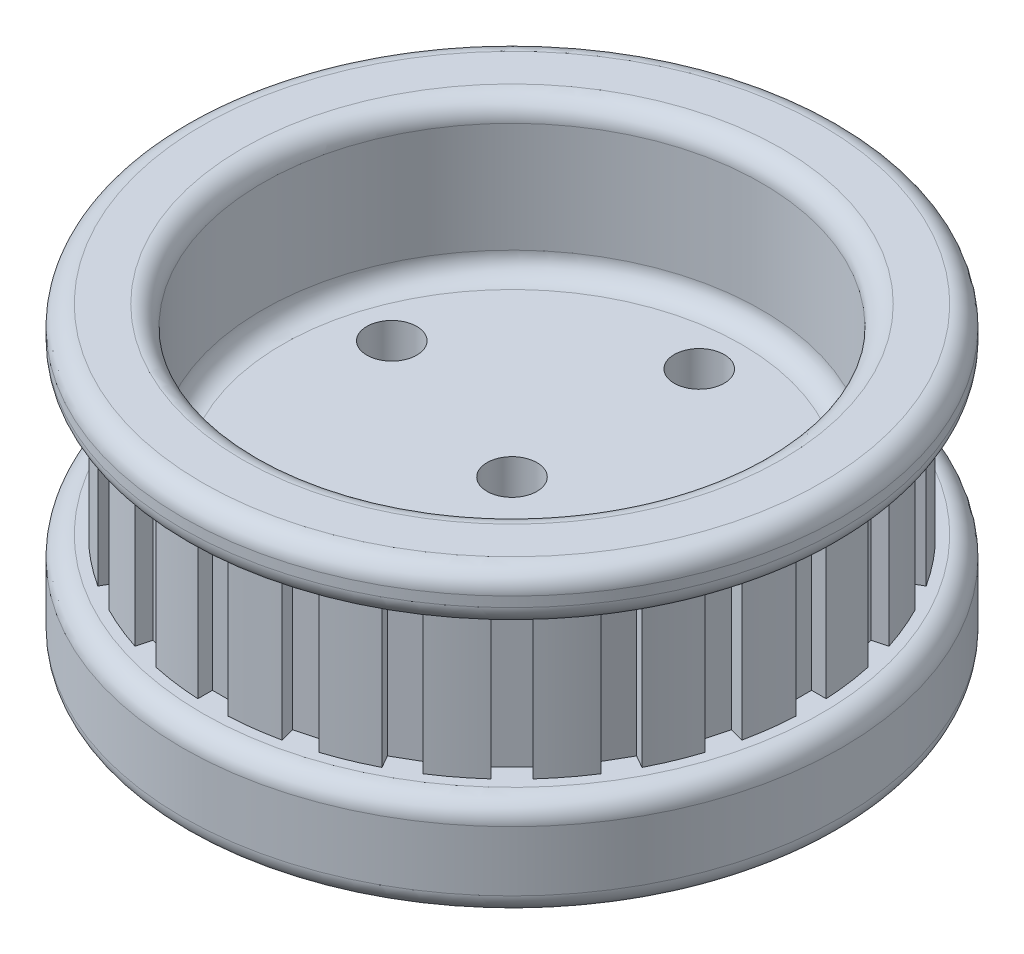
from build123d import *

# Parameters (mm, degrees)
SKETCH2_R          = 2.5
CUT_EXTRUDE1_DEPTH = 10
SKETCH3_W          = 3
SKETCH3_H          = 3
CUT_EXTRUDE2_DEPTH = 15
CIRPATTERN1_START  = 5
CIRPATTERN1_DEPTH  = 15
FILLET1_R          = 2


# Read off the part's stored shape, not the designer's step: CirPattern1
with BuildPart() as part:
    # Sketch1 → Revolve1 (revolve)
    with BuildSketch(Plane.XY, mode=Mode.PRIVATE) as revolve1_sk:
        Polygon((25, 10), (25, 25), (33, 25), (33, 20), (30, 20), (30, 5), (33, 5), (33, -5), (25, -5), (25, 0), (0, 0), (0, 10), align=None)
    revolve(revolve1_sk.sketch.rotate(Axis((0, 0, 0), (0, 1, 0)), 90), axis=Axis((0, 0, 0), (0, 1, 0)))

    # Sketch2 → Cut-Extrude1 (cut)
    with BuildSketch(Plane(origin=(0, 10, 0), x_dir=(1, 0, 0), z_dir=(0, 1, 0))):
        with Locations(Location((0, 0, 0), (0, 0, 270))):
            Circle(SKETCH2_R)
        with Locations(Location((0, 18.75, 0), (0, 0, 270))):
            Circle(SKETCH2_R)
        with Locations(Location((17.832309681, 5.794068645, 0), (0, 0, 270))):
            Circle(SKETCH2_R)
        with Locations(Location((11.02097348, -15.169068645, 0), (0, 0, 270))):
            Circle(SKETCH2_R)
        with Locations(Location((-11.02097348, -15.169068645, 0), (0, 0, 270))):
            Circle(SKETCH2_R)
        with Locations(Location((-17.832309681, 5.794068645, 0), (0, 0, 270))):
            Circle(SKETCH2_R)
    extrude(amount=-CUT_EXTRUDE1_DEPTH, mode=Mode.SUBTRACT)

    # Sketch3 → Cut-Extrude2 (cut)
    with BuildSketch(Plane(origin=(0, 5, 0), x_dir=(1, 0, 0), z_dir=(0, 1, 0))):
        with Locations((0, 30)):
            Rectangle(SKETCH3_W, SKETCH3_H)
    extrude(amount=CUT_EXTRUDE2_DEPTH, mode=Mode.SUBTRACT)

    # CirPattern1 outline → CirPattern1 (cut)
    with BuildSketch(Plane(origin=(0, 0, 0), x_dir=(1, 0, 0), z_dir=(0, 1, 0)).offset(CIRPATTERN1_START)):
        with BuildLine():
            Line((8.825231525, 27.140657482), (9.203748305, 28.553301335))
            ThreePointArc((9.203748305, 28.553301335), (7.764571353, 28.977774788), (6.305970826, 29.32975847))
            Line((6.305970826, 29.32975847), (5.927454046, 27.917114617))
            Line((5.927454046, 27.917114617), (8.825231525, 27.140657482))
        make_face()
        with BuildLine():
            Line((15.549038106, 23.931724008), (16.280276372, 25.198265838))
            ThreePointArc((16.280276372, 25.198265838), (15, 25.980762113), (13.682200161, 26.698265838))
            Line((13.682200161, 26.698265838), (12.950961894, 25.431724008))
            Line((12.950961894, 25.431724008), (15.549038106, 23.931724008))
        make_face()
        with BuildLine():
            Line((21.213203436, 19.091883092), (22.24733051, 20.126010166))
            ThreePointArc((22.24733051, 20.126010166), (21.213203436, 21.213203436), (20.126010166, 22.24733051))
            Line((20.126010166, 22.24733051), (19.091883092, 21.213203436))
            Line((19.091883092, 21.213203436), (21.213203436, 19.091883092))
        make_face()
        with BuildLine():
            Line((25.431724008, 12.950961894), (26.698265838, 13.682200161))
            ThreePointArc((26.698265838, 13.682200161), (25.980762113, 15), (25.198265838, 16.280276372))
            Line((25.198265838, 16.280276372), (23.931724008, 15.549038106))
            Line((23.931724008, 15.549038106), (25.431724008, 12.950961894))
        make_face()
        with BuildLine():
            Line((27.917114617, 5.927454046), (29.32975847, 6.305970826))
            ThreePointArc((29.32975847, 6.305970826), (28.977774789, 7.764571353), (28.553301335, 9.203748305))
            Line((28.553301335, 9.203748305), (27.140657482, 8.825231525))
            Line((27.140657482, 8.825231525), (27.917114617, 5.927454046))
        make_face()
        with BuildLine():
            Line((28.5, -1.5), (29.962476533, -1.5))
            ThreePointArc((29.962476533, -1.5), (30, 0), (29.962476533, 1.5))
            Line((29.962476533, 1.5), (28.5, 1.5))
            Line((28.5, 1.5), (28.5, -1.5))
        make_face()
        with BuildLine():
            Line((27.140657482, -8.825231525), (28.553301335, -9.203748305))
            ThreePointArc((28.553301335, -9.203748305), (28.977774789, -7.764571353), (29.329758471, -6.305970826))
            Line((29.329758471, -6.305970826), (27.917114617, -5.927454046))
            Line((27.917114617, -5.927454046), (27.140657482, -8.825231525))
        make_face()
        with BuildLine():
            Line((23.931724008, -15.549038106), (25.198265838, -16.280276372))
            ThreePointArc((25.198265838, -16.280276372), (25.980762114, -15), (26.698265838, -13.682200161))
            Line((26.698265838, -13.682200161), (25.431724008, -12.950961894))
            Line((25.431724008, -12.950961894), (23.931724008, -15.549038106))
        make_face()
        with BuildLine():
            Line((19.091883092, -21.213203436), (20.126010166, -22.24733051))
            ThreePointArc((20.126010166, -22.24733051), (21.213203436, -21.213203436), (22.24733051, -20.126010166))
            Line((22.24733051, -20.126010166), (21.213203436, -19.091883092))
            Line((21.213203436, -19.091883092), (19.091883092, -21.213203436))
        make_face()
        with BuildLine():
            Line((12.950961894, -25.431724008), (13.682200161, -26.698265838))
            ThreePointArc((13.682200161, -26.698265838), (15, -25.980762114), (16.280276372, -25.198265838))
            Line((16.280276372, -25.198265838), (15.549038106, -23.931724008))
            Line((15.549038106, -23.931724008), (12.950961894, -25.431724008))
        make_face()
        with BuildLine():
            Line((5.927454046, -27.917114617), (6.305970826, -29.329758471))
            ThreePointArc((6.305970826, -29.329758471), (7.764571353, -28.977774789), (9.203748305, -28.553301335))
            Line((9.203748305, -28.553301335), (8.825231525, -27.140657482))
            Line((8.825231525, -27.140657482), (5.927454046, -27.917114617))
        make_face()
        with BuildLine():
            ThreePointArc((-6.305970826, 29.32975847), (-7.764571353, 28.977774788), (-9.203748305, 28.553301335))
            Line((-9.203748305, 28.553301335), (-8.825231525, 27.140657482))
            Line((-8.825231525, 27.140657482), (-5.927454046, 27.917114617))
            Line((-5.927454046, 27.917114617), (-6.305970826, 29.32975847))
        make_face()
        with BuildLine():
            ThreePointArc((-13.682200161, 26.698265838), (-15, 25.980762113), (-16.280276372, 25.198265838))
            Line((-16.280276372, 25.198265838), (-15.549038106, 23.931724008))
            Line((-15.549038106, 23.931724008), (-12.950961894, 25.431724008))
            Line((-12.950961894, 25.431724008), (-13.682200161, 26.698265838))
        make_face()
        with BuildLine():
            ThreePointArc((-20.126010166, 22.24733051), (-21.213203436, 21.213203436), (-22.24733051, 20.126010166))
            Line((-22.24733051, 20.126010166), (-21.213203436, 19.091883092))
            Line((-21.213203436, 19.091883092), (-19.091883092, 21.213203436))
            Line((-19.091883092, 21.213203436), (-20.126010166, 22.24733051))
        make_face()
        with BuildLine():
            ThreePointArc((-25.198265838, 16.280276372), (-25.980762113, 15), (-26.698265838, 13.682200161))
            Line((-26.698265838, 13.682200161), (-25.431724008, 12.950961894))
            Line((-25.431724008, 12.950961894), (-23.931724008, 15.549038106))
            Line((-23.931724008, 15.549038106), (-25.198265838, 16.280276372))
        make_face()
        with BuildLine():
            ThreePointArc((-28.553301335, 9.203748305), (-28.977774789, 7.764571353), (-29.32975847, 6.305970826))
            Line((-29.32975847, 6.305970826), (-27.917114617, 5.927454046))
            Line((-27.917114617, 5.927454046), (-27.140657482, 8.825231525))
            Line((-27.140657482, 8.825231525), (-28.553301335, 9.203748305))
        make_face()
        with BuildLine():
            ThreePointArc((-29.962476533, 1.5), (-30, 0), (-29.962476533, -1.5))
            Line((-29.962476533, -1.5), (-28.5, -1.5))
            Line((-28.5, -1.5), (-28.5, 1.5))
            Line((-28.5, 1.5), (-29.962476533, 1.5))
        make_face()
        with BuildLine():
            ThreePointArc((-29.329758471, -6.305970826), (-28.977774789, -7.764571353), (-28.553301335, -9.203748305))
            Line((-28.553301335, -9.203748305), (-27.140657482, -8.825231525))
            Line((-27.140657482, -8.825231525), (-27.917114617, -5.927454046))
            Line((-27.917114617, -5.927454046), (-29.329758471, -6.305970826))
        make_face()
        with BuildLine():
            ThreePointArc((-26.698265838, -13.682200161), (-25.980762114, -15), (-25.198265838, -16.280276372))
            Line((-25.198265838, -16.280276372), (-23.931724008, -15.549038106))
            Line((-23.931724008, -15.549038106), (-25.431724008, -12.950961894))
            Line((-25.431724008, -12.950961894), (-26.698265838, -13.682200161))
        make_face()
        with BuildLine():
            ThreePointArc((-22.24733051, -20.126010166), (-21.213203436, -21.213203436), (-20.126010166, -22.24733051))
            Line((-20.126010166, -22.24733051), (-19.091883092, -21.213203436))
            Line((-19.091883092, -21.213203436), (-21.213203436, -19.091883092))
            Line((-21.213203436, -19.091883092), (-22.24733051, -20.126010166))
        make_face()
        with BuildLine():
            ThreePointArc((-16.280276372, -25.198265838), (-15, -25.980762114), (-13.682200161, -26.698265838))
            Line((-13.682200161, -26.698265838), (-12.950961894, -25.431724008))
            Line((-12.950961894, -25.431724008), (-15.549038106, -23.931724008))
            Line((-15.549038106, -23.931724008), (-16.280276372, -25.198265838))
        make_face()
        with BuildLine():
            ThreePointArc((-9.203748305, -28.553301335), (-7.764571353, -28.977774789), (-6.305970826, -29.329758471))
            Line((-6.305970826, -29.329758471), (-5.927454046, -27.917114617))
            Line((-5.927454046, -27.917114617), (-8.825231525, -27.140657482))
            Line((-8.825231525, -27.140657482), (-9.203748305, -28.553301335))
        make_face()
        with BuildLine():
            Line((1.5, -29.962476533), (1.5, -28.5))
            Line((1.5, -28.5), (-1.5, -28.5))
            Line((-1.5, -28.5), (-1.5, -29.962476533))
            ThreePointArc((-1.5, -29.962476533), (0, -30), (1.5, -29.962476533))
        make_face()
    extrude(amount=CIRPATTERN1_DEPTH, mode=Mode.SUBTRACT)

    # Fillet1
    fillet1_edges = [part.edges().sort_by_distance(p)[0] for p in [
        (0, -5, 25),
        (0, -5, 33),
        (0, 5, 33),
        (0, 20, 33),
        (0, 25, 33),
        (0, 25, 25),
        (0, 10, 25),
        (0, 0, 25),
    ]]
    fillet(fillet1_edges, radius=FILLET1_R)


solid = part.part
